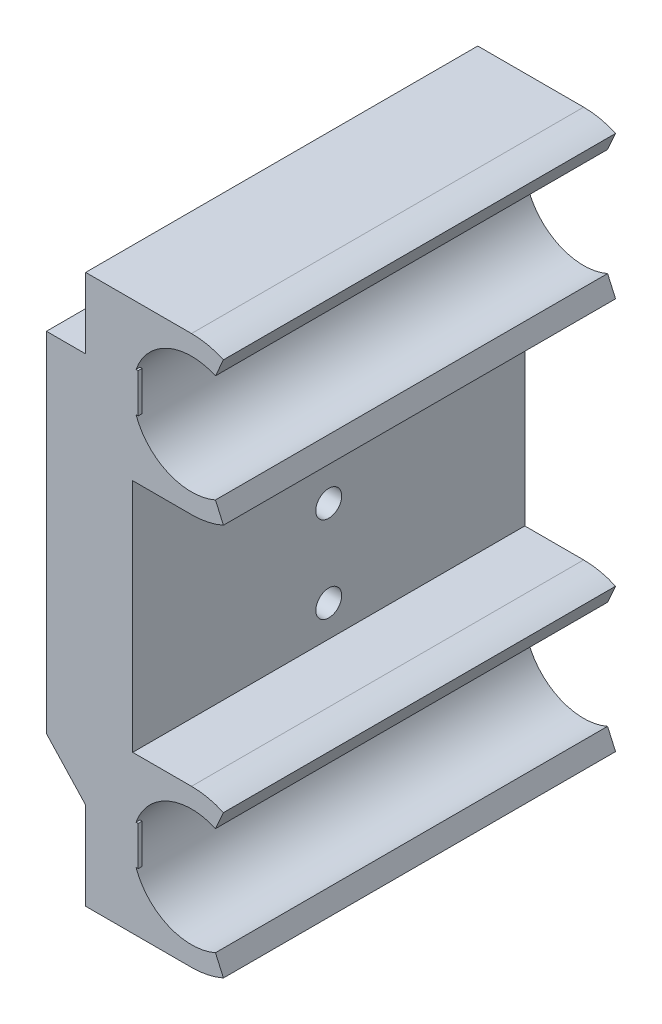
from build123d import *

# Parameters (mm, degrees)
RESSALTO_EXTRUS_O1_DEPTH   = 25
CORTE_EXTRUS_O3_DEPTH      = 6
CORTE_EXTRUS_O3_DEPTH_BACK = 10
ESBO_O6_R                  = 1.65
CORTE_EXTRUS_O5_DEPTH      = 3
ESBO_O10_W                 = 0.5
ESBO_O10_H                 = 5
RESSALTO_EXTRUS_O3_DEPTH   = 6.7
RESSALTO_EXTRUS_O4_DEPTH   = 5
CORTE_EXTRUS_O6_START      = -1
CORTE_EXTRUS_O6_DEPTH      = 4
CHANFRO1_SIZE              = 6.4
ESBO_O13_R                 = 1.65
CORTE_EXTRUS_O7_DEPTH      = 13
CORTE_EXTRUS_O8_START      = -4
CORTE_EXTRUS_O8_DEPTH      = 10
CHANFRO2_SIZE              = 6.4


with BuildPart() as part:
    # Esboço1 → Ressalto-extrusão1 (new, symmetric)
    with BuildSketch(Plane.XY):
        with BuildLine():
            Line((0, 35), (0, -35))
            Line((0, -35), (13.5, -35))
            ThreePointArc((13.5, -35), (15.581665999, -34.780933834), (17.572127481, -34.133333333))
            Line((17.572127481, -34.133333333), (16.554095611, -31.85))
            ThreePointArc((16.554095611, -31.85), (6, -25), (16.554095611, -18.15))
            Line((16.554095611, -18.15), (17.572127481, -15.866666667))
            ThreePointArc((17.572127481, -15.866666667), (15.581665999, -15.219066166), (13.5, -15))
            Line((13.5, -15), (6, -15))
            Line((6, -15), (6, 15))
            Line((6, 15), (13.5, 15))
            ThreePointArc((13.5, 15), (15.581665999, 15.219066166), (17.572127481, 15.866666667))
            Line((17.572127481, 15.866666667), (16.554095611, 18.15))
            ThreePointArc((16.554095611, 18.15), (6, 25), (16.554095611, 31.85))
            Line((16.554095611, 31.85), (17.572127481, 34.133333333))
            ThreePointArc((17.572127481, 34.133333333), (15.581665999, 34.780933834), (13.5, 35))
            Line((13.5, 35), (0, 35))
        make_face()
    extrude(amount=RESSALTO_EXTRUS_O1_DEPTH, both=True)

    # Esboço6 → Corte-extrusão3 (cut, two sides: drawn at the far end of the back side and taken through both)
    with BuildSketch(Plane(origin=(6, 0, 0), x_dir=(0, 0, -1), z_dir=(1, 0, 0)).offset(-CORTE_EXTRUS_O3_DEPTH_BACK)):
        with Locations(Location((0, 11, 0), (0, 0, 180))):
            Circle(ESBO_O6_R)
        with Locations(Location((0, -11, 0), (0, 0, 180))):
            Circle(ESBO_O6_R)
        with Locations(Location((0, 0, 0), (0, 0, 180))):
            Circle(ESBO_O6_R)
    extrude(amount=CORTE_EXTRUS_O3_DEPTH + CORTE_EXTRUS_O3_DEPTH_BACK, mode=Mode.SUBTRACT)

    # Esboço9 → Corte-extrusão5 (cut)
    with BuildSketch(Plane.ZY):
        Polygon((3.175426481, 11), (1.58771324, 13.75), (-1.58771324, 13.75), (-3.175426481, 11), (-1.58771324, 8.25), (1.58771324, 8.25), align=None)
        Polygon((3.175426481, 0), (1.58771324, 2.75), (-1.58771324, 2.75), (-3.175426481, 0), (-1.58771324, -2.75), (1.58771324, -2.75), align=None)
        Polygon((3.175426481, -11), (1.58771324, -8.25), (-1.58771324, -8.25), (-3.175426481, -11), (-1.58771324, -13.75), (1.58771324, -13.75), align=None)
    extrude(amount=-CORTE_EXTRUS_O5_DEPTH, mode=Mode.SUBTRACT)

    # Esboço10 → Ressalto-extrusão3 (add)
    with BuildSketch(Plane.ZY):
        with Locations((-24.75, 25)):
            Rectangle(ESBO_O10_W, ESBO_O10_H)
        with Locations((24.75, 25)):
            Rectangle(ESBO_O10_W, ESBO_O10_H)
        with Locations((24.75, -25)):
            Rectangle(ESBO_O10_W, ESBO_O10_H)
        with Locations((-24.75, -25)):
            Rectangle(ESBO_O10_W, ESBO_O10_H)
    extrude(amount=-RESSALTO_EXTRUS_O3_DEPTH)

    # Esboço11 → Ressalto-extrusão4 (add)
    with BuildSketch(Plane.ZY):
        Polygon((-17.5, -7), (0, -14), (17.5, -7), (17.5, 26), (25, 26), (25, -16.924395537), (0, -26.924395537), (-25, -16.924395537), (-25, 26), (-17.5, 26), align=None)
    extrude(amount=RESSALTO_EXTRUS_O4_DEPTH)

    # Esboço12 → Corte-extrusão6 (cut)
    with BuildSketch(Plane.ZY.offset(5).offset(CORTE_EXTRUS_O6_START)):
        Polygon((-17.5, -7), (17.5, -7), (17.5, -14), (0, -21), (-17.5, -14), align=None)
    extrude(amount=-CORTE_EXTRUS_O6_DEPTH, mode=Mode.SUBTRACT)

    # Chanfro1
    # the kernel refuses this chamfer: 6.4 mm, written as the material it adds along each edge
    with BuildSketch(Plane(origin=(-4, -27.112634139, 15.281585348), x_dir=(0.9996219169112968, -0.025529280528386773, -0.01021171221135471), z_dir=(0, 0.3713906763541037, -0.9284766908852593))) as chanfro1_piece_1_section:
        Polygon((CHANFRO1_SIZE * 0.999621916911, -CHANFRO1_SIZE * 0.0274958766106), (-CHANFRO1_SIZE * 0.0274958766106, -CHANFRO1_SIZE * 0.999621916911), (0, 0), align=None)
    chanfro1_piece_1 = extrude(amount=51.765619071, mode=Mode.PRIVATE)
    chanfro1_piece_1 = split(chanfro1_piece_1, bisect_by=Plane(origin=(-1.981352532, -15.655988855, -17.5), z_dir=(0, 0, 1)), keep=Keep.TOP, mode=Mode.PRIVATE)
    chanfro1_piece_1 = split(chanfro1_piece_1, bisect_by=Plane(origin=(-1.981352532, -22.750248134, -4.375620334), z_dir=(0, 0.9284766908852595, -0.37139067635410344)), keep=Keep.TOP, mode=Mode.PRIVATE)
    add(chanfro1_piece_1)
    with BuildSketch(Plane(origin=(-4, -7.887365861, 32.781585348), x_dir=(0.9996219169112968, -0.02552928052838657, 0.010211712211354616), z_dir=(0, -0.37139067635410344, -0.9284766908852595))) as chanfro1_piece_2_section:
        Polygon((CHANFRO1_SIZE * 0.999621916911, -CHANFRO1_SIZE * 0.0274958766106), (-CHANFRO1_SIZE * 0.0274958766106, -CHANFRO1_SIZE * 0.999621916911), (0, 0), align=None)
    chanfro1_piece_2 = extrude(amount=51.765619071, mode=Mode.PRIVATE)
    chanfro1_piece_2 = split(chanfro1_piece_2, bisect_by=Plane(origin=(-1.981352532, -22.750248134, 4.375620334), z_dir=(0, 0.9284766908852595, 0.3713906763541038)), keep=Keep.TOP, mode=Mode.PRIVATE)
    chanfro1_piece_2 = split(chanfro1_piece_2, bisect_by=Plane(origin=(-1.981352532, -15.655988855, 17.5), z_dir=(0, 0, -1)), keep=Keep.TOP, mode=Mode.PRIVATE)
    add(chanfro1_piece_2)

    # Esboço13 → Corte-extrusão7 (cut)
    with BuildSketch(Plane.ZY):
        with Locations((0, 30.5)):
            Circle(ESBO_O13_R)
    extrude(amount=-CORTE_EXTRUS_O7_DEPTH, mode=Mode.SUBTRACT)

    # Esboço14 → Corte-extrusão8 (cut)
    with BuildSketch(Plane.ZY.offset(CORTE_EXTRUS_O8_START)):
        Polygon((3.175426481, 30.5), (1.58771324, 33.25), (-1.58771324, 33.25), (-3.175426481, 30.5), (-1.58771324, 27.75), (1.58771324, 27.75), align=None)
    extrude(amount=-CORTE_EXTRUS_O8_DEPTH, mode=Mode.SUBTRACT)

    # Chanfro2
    # the kernel refuses this chamfer: 6.4 mm, written as the material it adds along each edge
    with BuildSketch(Plane(origin=(0, -33.037029676, 15.281585348), x_dir=(-0.9996219169112968, 0.02552928052838658, 0.010211712211354642), z_dir=(0, 0.37139067635410405, -0.9284766908852592))) as chanfro2_piece_1_section:
        Polygon((CHANFRO2_SIZE * 0.999621916911, -CHANFRO2_SIZE * 0.0274958766106), (-CHANFRO2_SIZE * 0.0274958766106, -CHANFRO2_SIZE * 0.999621916911), (0, 0), align=None)
    chanfro2_piece_1 = extrude(amount=59.843366282, mode=Mode.PRIVATE)
    chanfro2_piece_1 = split(chanfro2_piece_1, bisect_by=Plane(origin=(-5, -23.598020322, -13.89468732), z_dir=(1, 0, 0)), keep=Keep.TOP, mode=Mode.PRIVATE)
    chanfro2_piece_1 = split(chanfro2_piece_1, bisect_by=Plane(origin=(-1.952897505, -23.598020322, -25), z_dir=(0, 0, 1)), keep=Keep.TOP, mode=Mode.PRIVATE)
    chanfro2_piece_1 = split(chanfro2_piece_1, bisect_by=Plane(origin=(-1.952897505, -31.256856652, -10.831152788), z_dir=(0, 0.9284766908852593, -0.3713906763541039)), keep=Keep.TOP, mode=Mode.PRIVATE)
    add(chanfro2_piece_1)
    with BuildSketch(Plane(origin=(0, -10.811761398, 40.281585348), x_dir=(-0.9996219169112968, 0.02552928052838644, -0.010211712211354581), z_dir=(0, -0.3713906763541039, -0.9284766908852593))) as chanfro2_piece_2_section:
        Polygon((CHANFRO2_SIZE * 0.999621916911, -CHANFRO2_SIZE * 0.0274958766106), (-CHANFRO2_SIZE * 0.0274958766106, -CHANFRO2_SIZE * 0.999621916911), (0, 0), align=None)
    chanfro2_piece_2 = extrude(amount=59.843366282, mode=Mode.PRIVATE)
    chanfro2_piece_2 = split(chanfro2_piece_2, bisect_by=Plane(origin=(-5, -23.598020322, 13.89468732), z_dir=(1, 0, 0)), keep=Keep.TOP, mode=Mode.PRIVATE)
    chanfro2_piece_2 = split(chanfro2_piece_2, bisect_by=Plane(origin=(-1.952897505, -23.598020322, 25), z_dir=(0, 0, -1)), keep=Keep.TOP, mode=Mode.PRIVATE)
    chanfro2_piece_2 = split(chanfro2_piece_2, bisect_by=Plane(origin=(-1.952897505, -31.256856652, 10.831152788), z_dir=(0, 0.9284766908852592, 0.37139067635410405)), keep=Keep.TOP, mode=Mode.PRIVATE)
    add(chanfro2_piece_2)
    with BuildSketch(Plane(origin=(0, -10.811761398, 40.281585348), x_dir=(-0.9996219169112968, 0.02552928052838644, -0.010211712211354581), z_dir=(0, -0.3713906763541039, -0.9284766908852593))) as chanfro2_piece_3a_section:
        Polygon((CHANFRO2_SIZE * 0.999621916911, -CHANFRO2_SIZE * 0.0274958766106), (-CHANFRO2_SIZE * 0.0274958766106, -CHANFRO2_SIZE * 0.999621916911), (0, 0), align=None)
    chanfro2_piece_3a = extrude(amount=59.843366282, mode=Mode.PRIVATE)
    chanfro2_piece_3a = split(chanfro2_piece_3a, bisect_by=Plane(origin=(-5, -31.260156378, -5.039042683), z_dir=(1, 0, 0)), keep=Keep.TOP, mode=Mode.PRIVATE)
    chanfro2_piece_3a = split(chanfro2_piece_3a, bisect_by=Plane(origin=(-1.927343951, -25.78483059, -2.848912368), z_dir=(0, -0.9284766908852592, -0.37139067635410405)), keep=Keep.TOP, mode=Mode.PRIVATE)
    chanfro2_piece_3a = split(chanfro2_piece_3a, bisect_by=Plane(origin=(-1.927343951, -35, -5.039042683), z_dir=(0, 1, 0)), keep=Keep.TOP, mode=Mode.PRIVATE)
    with BuildSketch(Plane(origin=(0, -33.037029676, 15.281585348), x_dir=(-0.9996219169112968, 0.02552928052838658, 0.010211712211354642), z_dir=(0, 0.37139067635410405, -0.9284766908852592))) as chanfro2_piece_3b_section:
        Polygon((CHANFRO2_SIZE * 0.999621916911, -CHANFRO2_SIZE * 0.0274958766106), (-CHANFRO2_SIZE * 0.0274958766106, -CHANFRO2_SIZE * 0.999621916911), (0, 0), align=None)
    chanfro2_piece_3b = extrude(amount=59.843366282, mode=Mode.PRIVATE)
    chanfro2_piece_3b = split(chanfro2_piece_3b, bisect_by=Plane(origin=(-5, -31.260156378, 5.039042683), z_dir=(1, 0, 0)), keep=Keep.TOP, mode=Mode.PRIVATE)
    chanfro2_piece_3b = split(chanfro2_piece_3b, bisect_by=Plane(origin=(-1.927343951, -25.78483059, 2.848912368), z_dir=(0, -0.9284766908852593, 0.3713906763541039)), keep=Keep.TOP, mode=Mode.PRIVATE)
    chanfro2_piece_3b = split(chanfro2_piece_3b, bisect_by=Plane(origin=(-1.927343951, -35, 5.039042683), z_dir=(0, 1, 0)), keep=Keep.TOP, mode=Mode.PRIVATE)
    chanfro2_piece_3 = chanfro2_piece_3a & chanfro2_piece_3b
    add(chanfro2_piece_3)


solid = part.part
